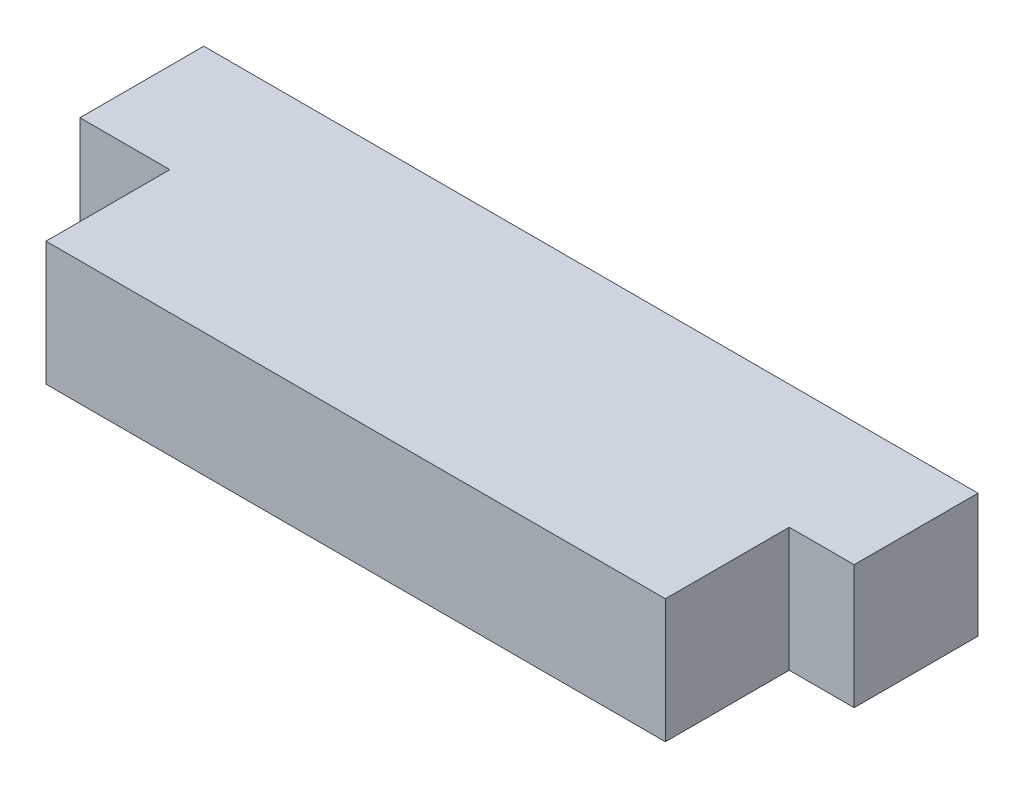
from build123d import *

# Parameters (mm, degrees)
BOSS_EXTRUDE1_DEPTH = 4


with BuildPart() as part:
    # Sketch1 → Boss-Extrude1 (new body)
    with BuildSketch(Plane(origin=(0, 0, 0), x_dir=(1, 0, 0), z_dir=(0, 1, 0))):
        Polygon((22.904936281, 0), (25, 0), (25, 4), (0, 4), (0, 0), (2.904936281, 0), (2.904936281, -4), (22.904936281, -4), align=None)
    extrude(amount=BOSS_EXTRUDE1_DEPTH)


solid = part.part
